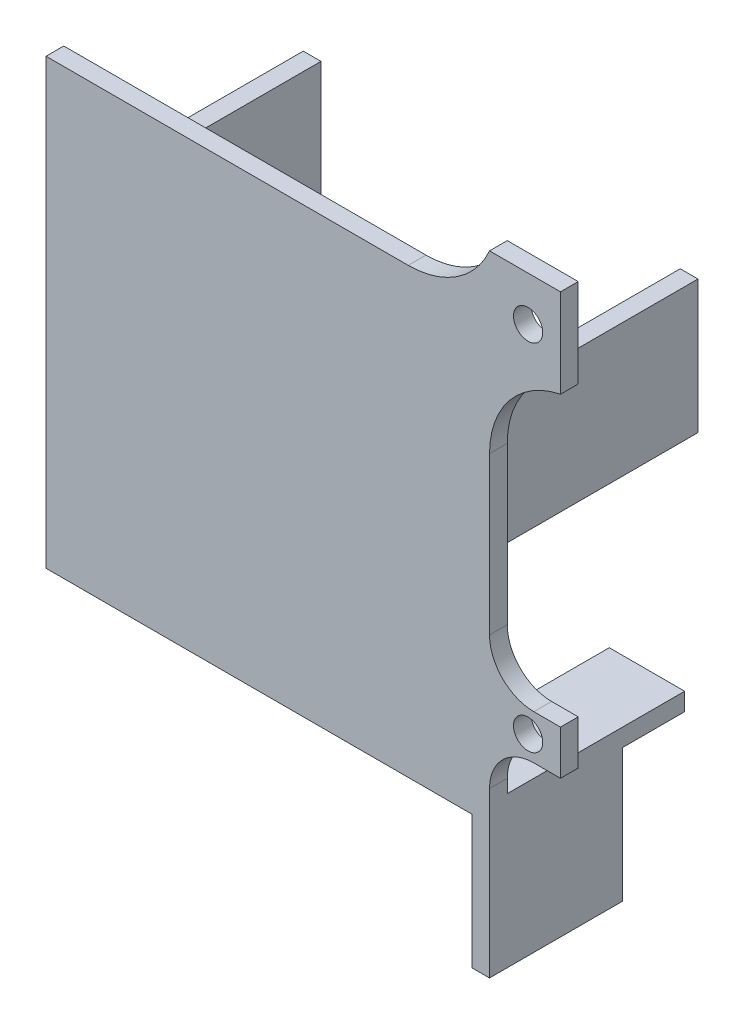
from build123d import *

# Parameters (mm, degrees)
SKETCH1_W               = 50
SKETCH1_H               = 50
BOSS_EXTRUDE1_DEPTH     = 2
SKETCH2_W               = 8.5
SKETCH2_H               = 2
SKETCH2_W_2             = 26.5
BOSS_EXTRUDE2_DEPTH     = 20
SKETCH3_W               = 2
SKETCH3_H               = 15
BOSS_EXTRUDE3_DEPTH     = 15
SKETCH5_W               = 2
SKETCH5_H               = 15
BOSS_EXTRUDE5_DEPTH     = 25
SKETCH6_W               = 8
SKETCH6_H               = 5
SKETCH6_H_2             = 10
BOSS_EXTRUDE6_DEPTH     = 2
FILLET1_R               = 10
FILLET2_R               = 10
FILLET3_R               = 5
CUT_EXTRUDE1_DEPTH      = 58.567351858
CUT_EXTRUDE1_DEPTH_BACK = 58.567351858
SKETCH7_R               = 1.65
SKETCH8_W               = 3.5
SKETCH8_H               = 6
BOSS_EXTRUDE7_DEPTH     = 8


with BuildPart() as part:
    # Sketch1 → Boss-Extrude1 (new body)
    with BuildSketch(Plane.XY):
        Rectangle(SKETCH1_W, SKETCH1_H)
    extrude(amount=BOSS_EXTRUDE1_DEPTH)

    # Sketch2 → Boss-Extrude2 (add)
    with BuildSketch(Plane(origin=(0, 0, 0), x_dir=(-1, 0, 0), z_dir=(0, 0, -1))):
        with Locations((-20.75, -24)):
            Rectangle(SKETCH2_W, SKETCH2_H)
        with Locations((11.75, -24)):
            Rectangle(SKETCH2_W_2, SKETCH2_H)
    extrude(amount=BOSS_EXTRUDE2_DEPTH)

    # Sketch3 → Boss-Extrude3 (add)
    with BuildSketch(Plane.XZ.offset(25)):
        with Locations((24, -5.5)):
            Rectangle(SKETCH3_W, SKETCH3_H)
    extrude(amount=BOSS_EXTRUDE3_DEPTH)

    # Sketch5 → Boss-Extrude5 (add)
    with BuildSketch(Plane(origin=(0, 0, 0), x_dir=(-1, 0, 0), z_dir=(0, 0, -1))):
        with Locations((-20.5, 5.5)):
            Rectangle(SKETCH5_W, SKETCH5_H)
        with Locations((22, 5.5)):
            Rectangle(SKETCH5_W, SKETCH5_H)
    extrude(amount=BOSS_EXTRUDE5_DEPTH)

    # Sketch6 → Boss-Extrude6 (add)
    with BuildSketch(Plane(origin=(0, 0, 0), x_dir=(-1, 0, 0), z_dir=(0, 0, -1))):
        with Locations((-29, -14)):
            Rectangle(SKETCH6_W, SKETCH6_H)
        with Locations((-29, 26)):
            Rectangle(SKETCH6_W, SKETCH6_H_2)
    extrude(amount=-BOSS_EXTRUDE6_DEPTH)

    # Fillet1
    # the kernel refuses this fillet: 10 mm, written as the material it adds along each edge
    with BuildSketch(Plane(origin=(25, 25, 0), x_dir=(-1, 0, 0), z_dir=(0, 0, 1))) as fillet1_piece_1:
        with BuildLine():
            CenterArc((9.16515139, -10), FILLET1_R, 90, 66.421821522)
            Line((0, -6), (-0.183303028, -5.92))
            ThreePointArc((-0.183303028, -5.92), (-0.2, -3), (-0.2, 0))
            Line((-0.2, 0), (0, 0.2))
            Line((0, 0.2), (9.16515139, 0.2))
            Line((9.16515139, 0.2), (9.16515139, 0))
        make_face()
    extrude(amount=2)

    # Fillet2
    # the kernel refuses this fillet: 10 mm, written as the material it adds along each edge
    with BuildSketch(Plane(origin=(25, 21, 0), x_dir=(0, -1, 0), z_dir=(0, 0, 1))) as fillet2_piece_1:
        with BuildLine():
            CenterArc((9.797958971, 10), FILLET2_R, 191.536959033, 78.463040967)
            Line((0, 8), (-0.195959179, 7.96))
            ThreePointArc((-0.195959179, 7.96), (-0.2, 4), (-0.2, 0))
            Line((-0.2, 0), (0, -0.2))
            Line((0, -0.2), (9.797958971, -0.2))
            Line((9.797958971, -0.2), (9.797958971, 0))
        make_face()
    extrude(amount=2)

    # Fillet3
    fillet3_edges = [part.edges().sort_by_distance(p)[0] for p in [
        (25, -16.5, 1),
        (25, -11.5, 1),
    ]]
    fillet(fillet3_edges, radius=FILLET3_R)

    # Sketch7 → Cut-Extrude1 (cut, two sides: drawn at the far end of the back side and taken through both)
    with BuildSketch(Plane(origin=(0, 0, 0), x_dir=(-1, 0, 0), z_dir=(0, 0, -1)).offset(-CUT_EXTRUDE1_DEPTH_BACK)):
        with Locations((-29.35, -14)):
            Circle(SKETCH7_R)
        with Locations((-29.35, 26)):
            Circle(SKETCH7_R)
    extrude(amount=CUT_EXTRUDE1_DEPTH + CUT_EXTRUDE1_DEPTH_BACK, mode=Mode.SUBTRACT)

    # Sketch8 → Boss-Extrude7 (add)
    with BuildSketch(Plane(origin=(0, 0, 0), x_dir=(-1, 0, 0), z_dir=(0, 0, -1))):
        with Locations((23.25, -11)):
            Rectangle(SKETCH8_W, SKETCH8_H)
    extrude(amount=BOSS_EXTRUDE7_DEPTH)


solid = part.part
